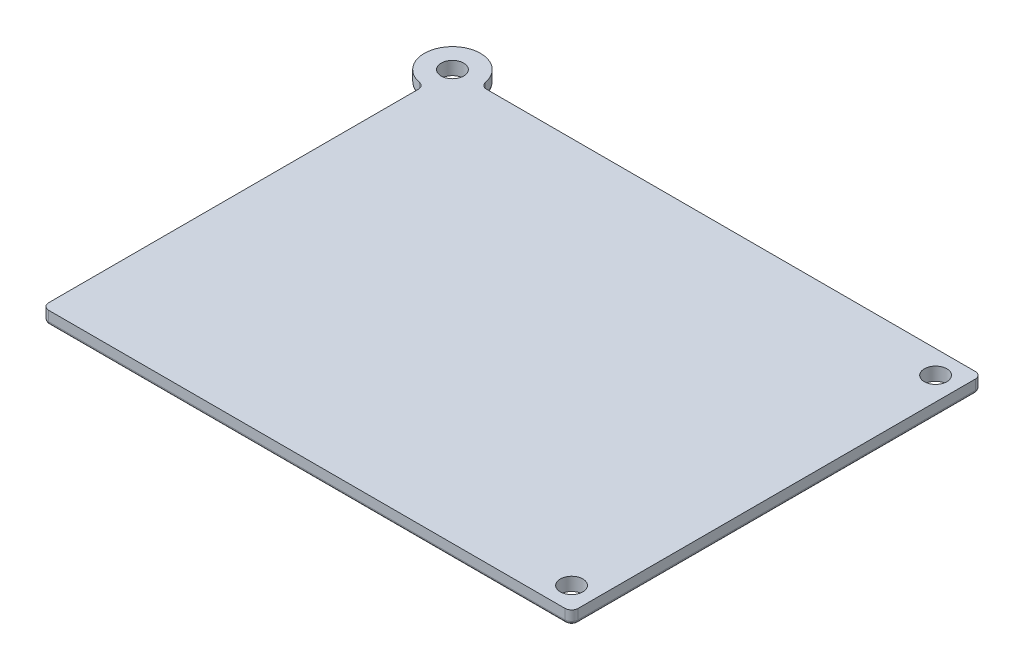
from build123d import *

# Parameters (mm, degrees)
MAIN_BODY_DEPTH        = 2
CORNERS_R              = 1
EDGE_2_R               = 0.5
LID_HOLES_DEPTH        = 57.609407345
LID_HOLES_DEPTH_BACK   = 57.609407345
SKETCH7_R              = 1.7
SKETCH4_R              = 2.325
BOSS_EXTRUDE3_DEPTH    = 1.6
FILLET3_R              = 0.05
LPATTERN5_COUNT        = 4
LPATTERN5_PITCH        = 8
FILLET3_OF_LPATTERN5_R = 0.05
SKETCH9_R              = 2.325
PEGS_DIAGONAL_DEPTH    = 1.6
FILLET6_R              = 0.05
LPATTERN6_COUNT        = 4
LPATTERN6_PITCH        = 8


with BuildPart() as part:
    # Sketch1 → Main Body (new body)
    with BuildSketch(Plane(origin=(0, 0, 0), x_dir=(1, 0, 0), z_dir=(0, 1, 0))):
        with BuildLine():
            Line((-40, -31), (40, -31))
            Line((40, -31), (40, 31))
            Line((40, 31), (-34.846117968, 31))
            ThreePointArc((-34.846117968, 31), (-35.482326978, 31.22848325), (-35.827809784, 31.80952381))
            ThreePointArc((-35.827809784, 31.80952381), (-43.00520382, 34.00520382), (-40.80952381, 26.827809784))
            ThreePointArc((-40.80952381, 26.827809784), (-40.22848325, 26.482326978), (-40, 25.846117968))
            Line((-40, 25.846117968), (-40, -31))
        make_face()
    extrude(amount=MAIN_BODY_DEPTH)

    # Corners
    corners_edges = [part.edges().sort_by_distance(p)[0] for p in [
        (-40, 1, 31),
        (40, 1, -31),
        (40, 1, 31),
    ]]
    fillet(corners_edges, radius=CORNERS_R)

    # Edge 2
    edge_2_edges = [part.edges().sort_by_distance(p)[0] for p in [
        (-39.707106781, 0, 30.707106781),
        (39.707106781, 0, -30.707106781),
        (39.707106781, 0, 30.707106781),
        (-40, 0, 2.076941016),
        (2.076941016, 0, -31),
        (40, 0, 0),
        (0, 0, 31),
        (-40.22848325, 0, -26.482326978),
        (-43.00520382, 0, -34.00520382),
        (-35.482326978, 0, -31.22848325),
    ]]
    fillet(edge_2_edges, radius=EDGE_2_R)

    # Sketch7 → Lid Holes (cut, two sides: drawn at the far end of the back side and taken through both)
    with BuildSketch(Plane(origin=(0, 0, 0), x_dir=(-1, 0, 0), z_dir=(0, -1, 0)).offset(-LID_HOLES_DEPTH_BACK)):
        with Locations((-36.5, 27.5)):
            Circle(SKETCH7_R)
        with Locations((-36.5, -27.5)):
            Circle(SKETCH7_R)
        with Locations((40, 31)):
            Circle(SKETCH7_R)
    extrude(amount=LID_HOLES_DEPTH + LID_HOLES_DEPTH_BACK, mode=Mode.SUBTRACT)

    # Sketch4 → Boss-Extrude3 (add)
    with BuildSketch(Plane(origin=(0, 0, 0), x_dir=(-1, 0, 0), z_dir=(0, -1, 0))):
        with Locations((-34.403805922, -19.746951673)):
            Circle(SKETCH4_R)
        with Locations((-28.746951673, -25.403805922)):
            Circle(SKETCH4_R)
    boss_extrude3 = extrude(amount=BOSS_EXTRUDE3_DEPTH)

    # Fillet3
    fillet3_edges = [part.edges().sort_by_distance(p)[0] for p in [
        (36.728805922, -1.6, 19.746951673),
        (31.071951673, -1.6, 25.403805922),
    ]]
    fillet(fillet3_edges, radius=FILLET3_R)

    # LPattern5: Boss-Extrude3 ×4
    with Locations(*[Vector(-0.7071067811865476, 0, -0.7071067811865476) * (i * LPATTERN5_PITCH) for i in range(1, LPATTERN5_COUNT)]):
        add(boss_extrude3)

    # Fillet3 of LPattern5
    fillet3_of_lpattern5_edges = [part.edges().sort_by_distance(p)[0] for p in [
        (31.071951673, -1.6, 14.090097423),
        (25.415097423, -1.6, 19.746951673),
        (25.415097423, -1.6, 8.433243174),
        (19.758243174, -1.6, 14.090097423),
        (19.758243174, -1.6, 2.776388924),
        (14.101388924, -1.6, 8.433243174),
    ]]
    fillet(fillet3_of_lpattern5_edges, radius=FILLET3_OF_LPATTERN5_R)

    # Sketch9 → Pegs (Diagonal) (add)
    with BuildSketch(Plane(origin=(0, 0, 0), x_dir=(-1, 0, 0), z_dir=(0, -1, 0))):
        with Locations((27.31698357, -25.389425923)):
            Circle(SKETCH9_R)
        with Locations((32.309292455, -19.138277869)):
            Circle(SKETCH9_R)
    pegs_diagonal = extrude(amount=PEGS_DIAGONAL_DEPTH)

    # Fillet6
    fillet6_edges = [part.edges().sort_by_distance(p)[0] for p in [
        (-24.99198357, -1.6, 25.389425923),
        (-29.984292455, -1.6, 19.138277869),
    ]]
    fillet(fillet6_edges, radius=FILLET6_R)

    # LPattern6: Pegs (Diagonal) ×4
    with Locations(*[Vector(0.7813935067873017, 0, -0.6240386106248901) * (i * LPATTERN6_PITCH) for i in range(1, LPATTERN6_COUNT)]):
        add(pegs_diagonal)


solid = part.part
